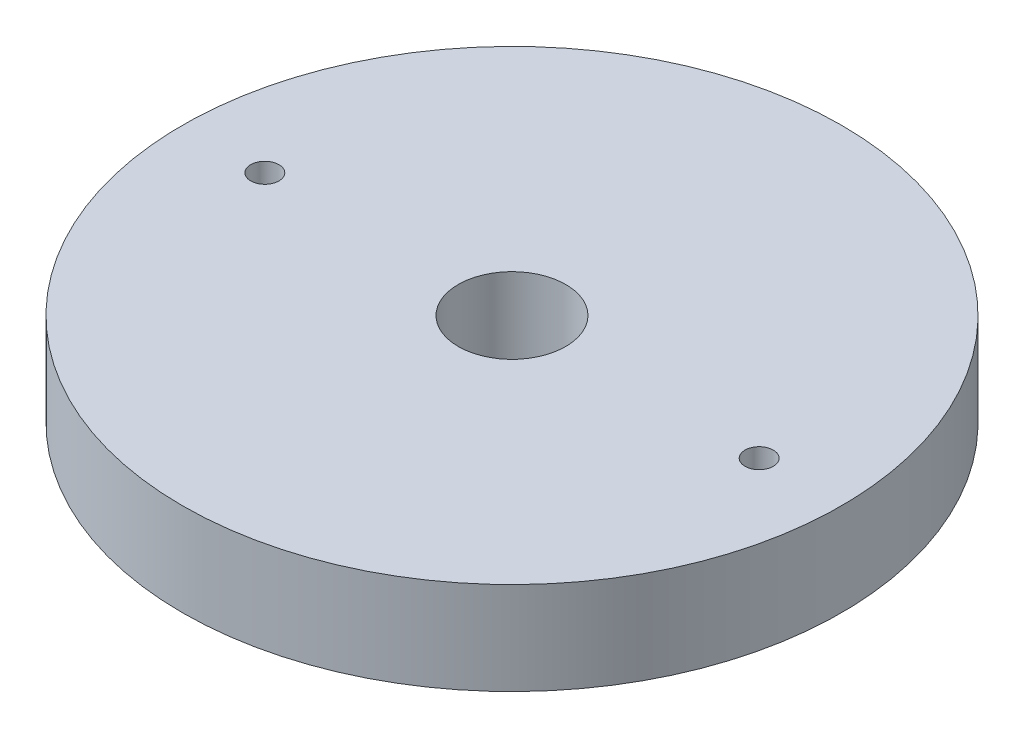
from build123d import *

# Parameters (mm, degrees)
SKETCH1_R            = 17.78
SKETCH1_R_2          = 0.762
BOSS_EXTRUDE1_DEPTH  = 5
SKETCH5_R            = 2.667
CUT_EXTRUDE1_DEPTH   = 3
M5_CLEARANCE_HOLE2_D = 5.8


with BuildPart() as part:
    # Sketch1 → Boss-Extrude1 (new body)
    with BuildSketch(Plane(origin=(0, 0, 0), x_dir=(1, 0, 0), z_dir=(0, 1, 0))):
        Circle(SKETCH1_R)
        with Locations((-13.335, 0)):
            Circle(SKETCH1_R_2, mode=Mode.SUBTRACT)
        with Locations((13.335, 0)):
            Circle(SKETCH1_R_2, mode=Mode.SUBTRACT)
    extrude(amount=BOSS_EXTRUDE1_DEPTH)

    # Sketch5 → Cut-Extrude1 (cut)
    with BuildSketch(Plane.XZ):
        with Locations((0, 13.97)):
            Circle(SKETCH5_R)
    extrude(amount=-CUT_EXTRUDE1_DEPTH, mode=Mode.SUBTRACT)

    # M5 Clearance Hole2 (through all)
    with Locations(Plane(origin=(0, 5, 0), x_dir=(1, 0, 0), z_dir=(0, 1, 0))):
        with Locations((0, 0)):
            Hole(M5_CLEARANCE_HOLE2_D / 2)


solid = part.part
